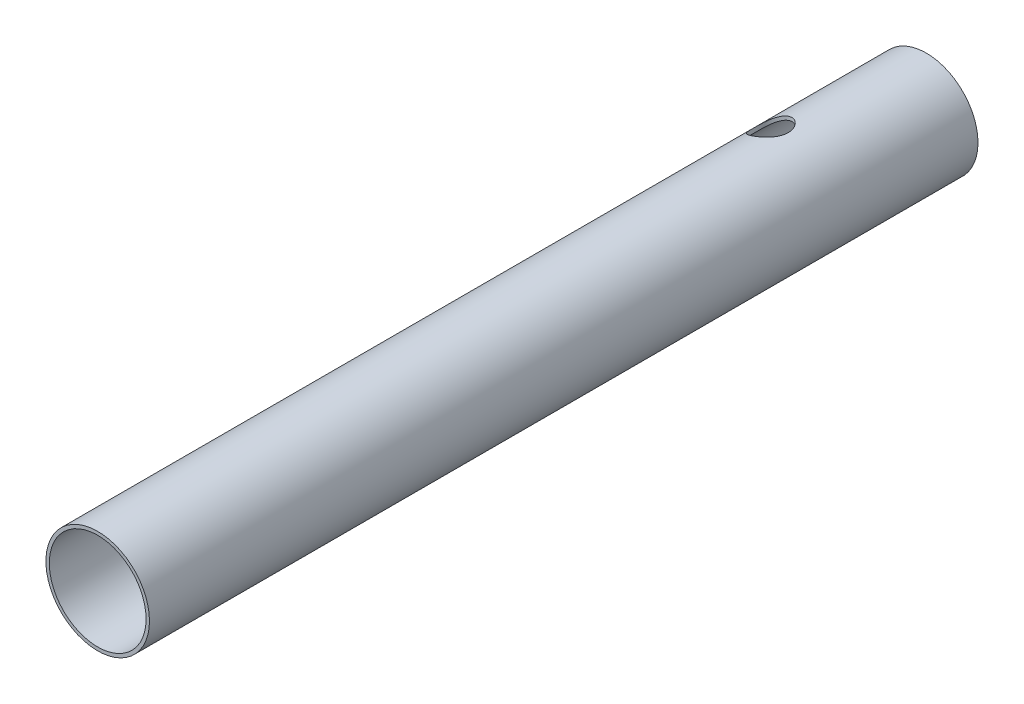
from build123d import *

# Parameters (mm, degrees)
SKETCH3_R           = 19.05
SKETCH3_R_2         = 17.8054
BOSS_EXTRUDE1_DEPTH = 152.4
SKETCH4_R           = 6.35
CUT_EXTRUDE1_DEPTH  = 160.888914563


with BuildPart() as part:
    # Sketch3 → Boss-Extrude1 (new, symmetric)
    with BuildSketch(Plane.XY):
        Circle(SKETCH3_R)
        Circle(SKETCH3_R_2, mode=Mode.SUBTRACT)
    extrude(amount=BOSS_EXTRUDE1_DEPTH, both=True)

    # Sketch4 → Cut-Extrude1 (cut, through all)
    with BuildSketch(Plane(origin=(0, 25.4, 0), x_dir=(1, 0, 0), z_dir=(0, 1, 0))):
        with Locations((-6.35, 101.6)):
            Circle(SKETCH4_R)
    extrude(amount=-CUT_EXTRUDE1_DEPTH, mode=Mode.SUBTRACT)


solid = part.part
